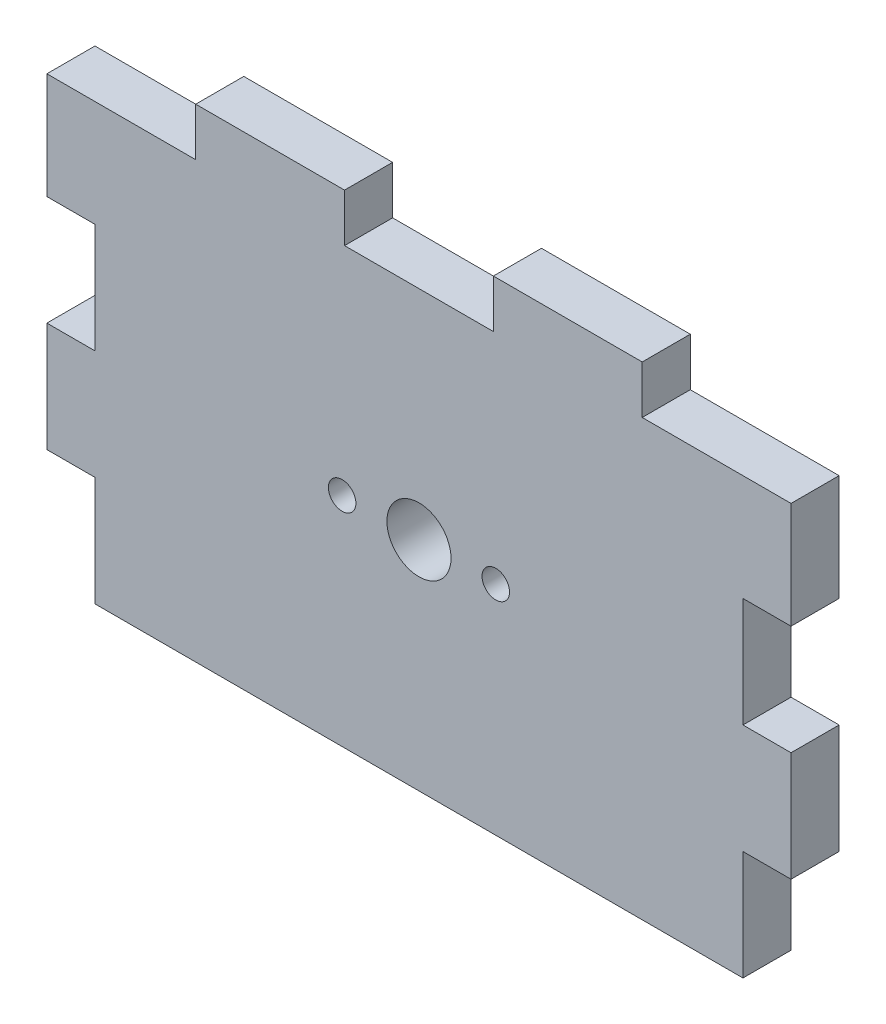
from build123d import *

# Parameters (mm, degrees)
SKETCH1_W                = 82.55
SKETCH1_H                = 53.594
BOSS_EXTRUDE1_DEPTH      = 5.334
CUT_EXTRUDE1_START       = -88.085249325
CUT_EXTRUDE1_OUTLINE_W   = 5.334
CUT_EXTRUDE1_OUTLINE_H   = 5.334
CUT_EXTRUDE1_DEPTH       = 16.51
CUT_EXTRUDE1_START_2     = -55.065249325
CUT_EXTRUDE1_2_OUTLINE_W = 5.334
CUT_EXTRUDE1_2_OUTLINE_H = 5.334
CUT_EXTRUDE1_2_DEPTH     = 16.51
CUT_EXTRUDE1_START_3     = -22.045249325
CUT_EXTRUDE1_3_OUTLINE_W = 5.334
CUT_EXTRUDE1_3_OUTLINE_H = 5.334
CUT_EXTRUDE1_3_DEPTH     = 16.51
SKETCH3_W                = 5.334
SKETCH3_H                = 12.154056038
CUT_EXTRUDE2_DEPTH       = 97.676684204
SKETCH4_R                = 3.556
SKETCH4_R_2              = 1.524
CUT_EXTRUDE3_DEPTH       = 97.676684204


# Read off the part's stored shape, not the designer's step: Cut-Extrude1
with BuildPart() as part:
    # Sketch1 → Boss-Extrude1 (new body)
    with BuildSketch(Plane.XY):
        with Locations((-46.810249325, -12.686142782)):
            Rectangle(SKETCH1_W, SKETCH1_H)
    extrude(amount=BOSS_EXTRUDE1_DEPTH)

    # Cut-Extrude1 outline → Cut-Extrude1 (cut)
    with BuildSketch(Plane.YZ.offset(CUT_EXTRUDE1_START)):
        with Locations((11.443857218, 2.667)):
            Rectangle(CUT_EXTRUDE1_OUTLINE_W, CUT_EXTRUDE1_OUTLINE_H)
    extrude(amount=CUT_EXTRUDE1_DEPTH, mode=Mode.SUBTRACT)

    # Cut-Extrude1 2 outline → Cut-Extrude1 2 (cut)
    with BuildSketch(Plane.YZ.offset(CUT_EXTRUDE1_START_2)):
        with Locations((11.443857218, 2.667)):
            Rectangle(CUT_EXTRUDE1_2_OUTLINE_W, CUT_EXTRUDE1_2_OUTLINE_H)
    extrude(amount=CUT_EXTRUDE1_2_DEPTH, mode=Mode.SUBTRACT)

    # Cut-Extrude1 3 outline → Cut-Extrude1 3 (cut)
    with BuildSketch(Plane.YZ.offset(CUT_EXTRUDE1_START_3)):
        with Locations((11.443857218, 2.667)):
            Rectangle(CUT_EXTRUDE1_3_OUTLINE_W, CUT_EXTRUDE1_3_OUTLINE_H)
    extrude(amount=CUT_EXTRUDE1_3_DEPTH, mode=Mode.SUBTRACT)

    # Sketch3 → Cut-Extrude2 (cut, through all)
    with BuildSketch(Plane.XY.offset(5.334)):
        with Locations((-85.418249325, -33.406114763)):
            Rectangle(SKETCH3_W, SKETCH3_H)
        with Locations((-85.418249325, -9.098002686)):
            Rectangle(SKETCH3_W, SKETCH3_H)
        with Locations((-8.202249325, -33.406114763)):
            Rectangle(SKETCH3_W, SKETCH3_H)
        with Locations((-8.202249325, -9.098002686)):
            Rectangle(SKETCH3_W, SKETCH3_H)
    extrude(amount=-CUT_EXTRUDE2_DEPTH, mode=Mode.SUBTRACT)

    # Sketch4 → Cut-Extrude3 (cut, through all)
    with BuildSketch(Plane.XY.offset(5.334)):
        with Locations((-46.810249325, -15.353142782)):
            Circle(SKETCH4_R)
        with Locations((-55.331949325, -15.353142782)):
            Circle(SKETCH4_R_2)
        with Locations(Location((-38.288549325, -15.353142782, 0), (0, 0, 180))):
            Circle(SKETCH4_R_2)
    extrude(amount=-CUT_EXTRUDE3_DEPTH, mode=Mode.SUBTRACT)


solid = part.part
